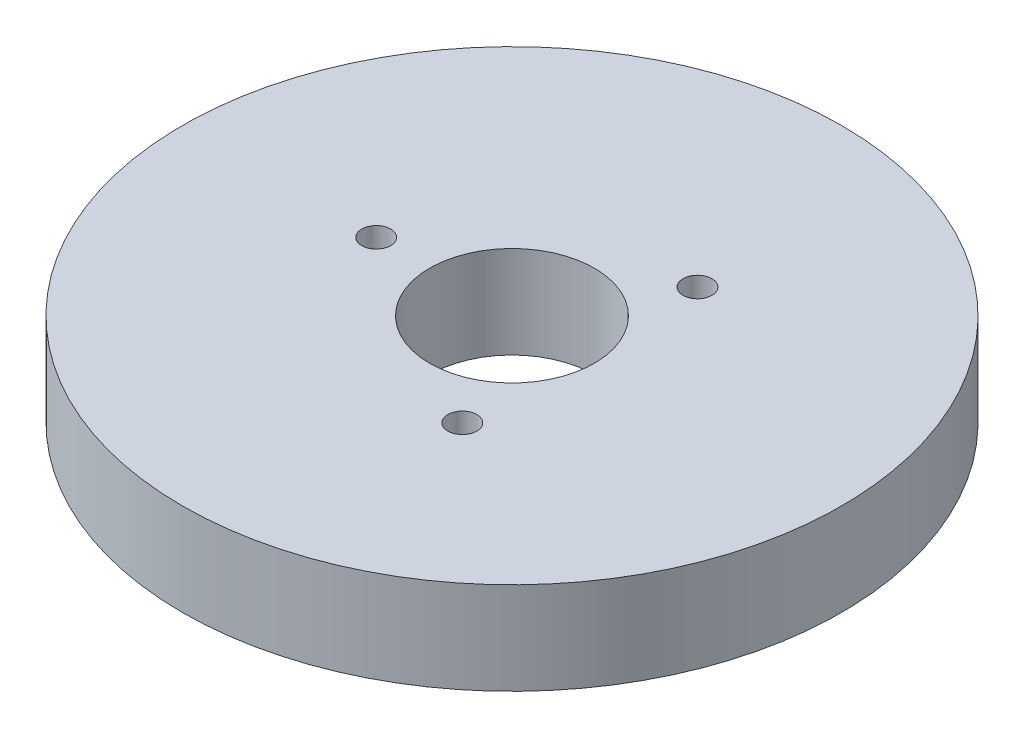
from build123d import *

# Parameters (mm, degrees)
SKETCH1_R           = 100
BOSS_EXTRUDE1_DEPTH = 28
SKETCH2_R           = 25
CUT_EXTRUDE1_DEPTH  = 145.166570328
SKETCH3_R           = 4.386577005
CUT_EXTRUDE2_DEPTH  = 23.837684128
CIRPATTERN1_COUNT   = 3


with BuildPart() as part:
    # Sketch1 → Boss-Extrude1 (new body)
    with BuildSketch(Plane(origin=(0, 0, 0), x_dir=(1, 0, 0), z_dir=(0, 1, 0))):
        Circle(SKETCH1_R)
    extrude(amount=BOSS_EXTRUDE1_DEPTH)

    # Sketch2 → Cut-Extrude1 (cut, through all)
    with BuildSketch(Plane(origin=(0, 0, 0), x_dir=(1, 0, 0), z_dir=(0, 1, 0))):
        Circle(SKETCH2_R)
    extrude(amount=CUT_EXTRUDE1_DEPTH, mode=Mode.SUBTRACT)

    # Sketch3 → Cut-Extrude2 (cut)
    with BuildSketch(Plane(origin=(0, 28, 0), x_dir=(1, 0, 0), z_dir=(0, 1, 0))):
        with Locations((-41.201695718, 0)):
            Circle(SKETCH3_R)
    cut_extrude2 = extrude(amount=-CUT_EXTRUDE2_DEPTH, mode=Mode.SUBTRACT)

    # CirPattern1: Cut-Extrude2 ×3 about axis
    cirpattern1_axis = Axis((0, 0, 0), (0, 1, 0))
    for i in range(1, CIRPATTERN1_COUNT):
        add(cut_extrude2.rotate(cirpattern1_axis, i * 360 / CIRPATTERN1_COUNT), mode=Mode.SUBTRACT)


solid = part.part
